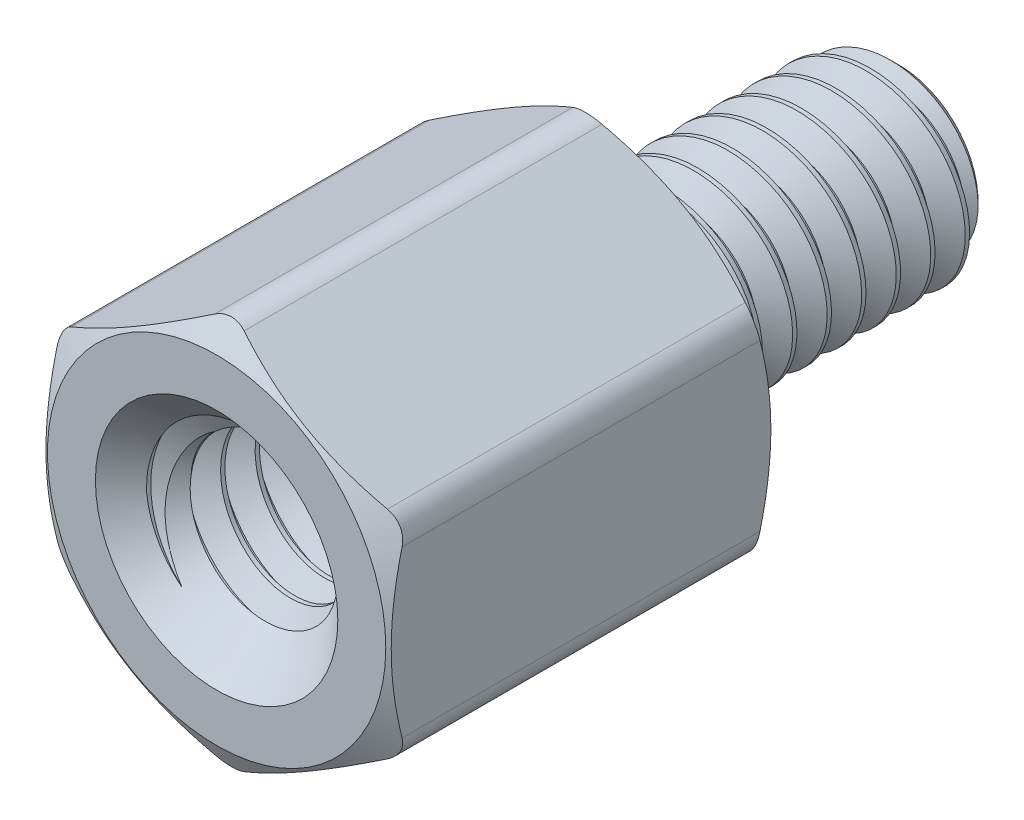
from build123d import *

# Parameters (mm, degrees)
SKETCH4_R           = 1.75
BOSS_EXTRUDE1_DEPTH = 5
SKETCH5_OUTSIDE_W   = 45.262
SKETCH5_OUTSIDE_H   = 45.958
SKETCH5_OUTSIDE_R   = 2.205
CUT_EXTRUDE1_DEPTH  = 10.540571262
CUT_EXTRUDE1_DRAFT  = -60
SKETCH6_OUTSIDE_W   = 33.232
SKETCH6_OUTSIDE_H   = 33.928
SKETCH6_OUTSIDE_R   = 2.205
CUT_EXTRUDE2_DEPTH  = 7.06733055
CUT_EXTRUDE2_DRAFT  = -60
FILLET1_R           = 0.3825
CUT_SWEEP1_PITCH    = 0.45
SKETCH9_R           = 1.475
BOSS_EXTRUDE2_DEPTH = 1.9
SKETCH10_W          = 1.9
SKETCH10_H          = 1.25
CUT_SWEEP2_PITCH    = 0.45


with BuildPart() as part:
    # Sketch3 → Revolve1 (revolve)
    with BuildSketch(Plane(origin=(0, 0, 0), x_dir=(0, 0, -1), z_dir=(1, 0, 0))):
        with BuildLine():
            Line((-3.1, 1.025), (-3.1, 0))
            Line((-3.1, 0), (3.9, 0))
            Line((3.9, 0), (3.9, 1.025))
            Line((3.9, 1.025), (3.675, 1.25))
            Line((3.675, 1.25), (0.63675, 1.25))
            Line((0.63675, 1.25), (0.468, 0.957716426))
            Line((0.468, 0.957716426), (0.225, 0.957716426))
            ThreePointArc((0.225, 0.957716426), (0.065900974, 1.0236174), (0, 1.182716426))
            Line((0, 1.182716426), (0, 2.25))
            Line((0, 2.25), (-5, 2.25))
            Line((-5, 2.25), (-5, 1.475))
            Line((-5, 1.475), (-4.775, 1.25))
            Line((-4.775, 1.25), (-3.325, 1.25))
            Line((-3.325, 1.25), (-3.1, 1.025))
        make_face()
    revolve(axis=Axis((0, 0, -3.9), (0, 0, 1)))

    # Sketch4 → Boss-Extrude1 (add)
    with BuildSketch(Plane.XY.offset(5)):
        Polygon((-2.25, 1.299038106), (-2.25, -1.299038106), (0, -2.598076211), (2.25, -1.299038106), (2.25, 1.299038106), (0, 2.598076211), align=None)
        Circle(SKETCH4_R, mode=Mode.SUBTRACT)
    extrude(amount=-BOSS_EXTRUDE1_DEPTH)


with BuildPart() as cut_extrude1_tool:
    # Sketch5 outside → Cut-Extrude1 (with draft: the straight prism first)
    with BuildSketch(Plane.XY.offset(5)):
        Rectangle(SKETCH5_OUTSIDE_W, SKETCH5_OUTSIDE_H)
        Circle(SKETCH5_OUTSIDE_R, mode=Mode.SUBTRACT)
    extrude(amount=-CUT_EXTRUDE1_DEPTH)
    # Cut-Extrude1: the draft: its side faces are tilted about the plane it starts from
    cut_extrude1_sides = [cut_extrude1_tool.faces().sort_by_distance(p)[0] for p in [
        (0, -22.979, -0.270285631),
        (22.631, 0, -0.270285631),
        (0, 22.979, -0.270285631),
        (-22.631, 0, -0.270285631),
        (-2.205, 0, -0.270285631),
    ]]
    draft(cut_extrude1_sides, Plane.XY.offset(5), CUT_EXTRUDE1_DRAFT)


with BuildPart() as part_1:
    add(part.part)

    # Cut-Extrude1: cut by cut_extrude1_tool
    add(cut_extrude1_tool.part, mode=Mode.SUBTRACT)


with BuildPart() as cut_extrude2_tool:
    # Sketch6 outside → Cut-Extrude2 (with draft: the straight prism first)
    with BuildSketch(Plane(origin=(0, 0, 0), x_dir=(-1, 0, 0), z_dir=(0, 0, -1))):
        Rectangle(SKETCH6_OUTSIDE_W, SKETCH6_OUTSIDE_H)
        Circle(SKETCH6_OUTSIDE_R, mode=Mode.SUBTRACT)
    extrude(amount=-CUT_EXTRUDE2_DEPTH)
    # Cut-Extrude2: the draft: its side faces are tilted about the plane it starts from
    cut_extrude2_sides = [cut_extrude2_tool.faces().sort_by_distance(p)[0] for p in [
        (0, -16.964, 3.533665275),
        (-16.616, 0, 3.533665275),
        (0, 16.964, 3.533665275),
        (16.616, 0, 3.533665275),
        (2.205, 0, 3.533665275),
    ]]
    draft(cut_extrude2_sides, Plane(origin=(0, 0, 0), x_dir=(-1, 0, 0), z_dir=(0, 0, -1)), CUT_EXTRUDE2_DRAFT)


with BuildPart() as part_2:
    add(part_1.part)

    # Cut-Extrude2: cut by cut_extrude2_tool
    add(cut_extrude2_tool.part, mode=Mode.SUBTRACT)

    # Fillet1
    fillet1_edges = [part_2.edges().sort_by_distance(p)[0] for p in [
        (0, 2.598076211, 2.5),
        (-2.25, -1.299038106, 2.5),
        (0, -2.598076211, 2.5),
        (2.25, -1.299038106, 2.5),
        (2.25, 1.299038106, 2.5),
        (-2.25, 1.299038106, 2.5),
    ]]
    fillet(fillet1_edges, radius=FILLET1_R)

    # Cut-Sweep1: the profile of Sketch7 profile screwed along a right-hand helix of 8.406667 turns, 6 arcs to a turn; built about Z, then put on its axis
    cut_sweep1_z = Axis((0, 0, 0), (0, 0, 1))
    cut_sweep1_corners = [(0.957416426, 0, -0.168923205), (0.957416426, 0, -0.224826795), (1.274356964, 0, -0.4078125), (1.274356964, 0, 0.0140625)]
    with BuildLine(mode=Mode.PRIVATE) as cut_sweep1_profile:
        Line(cut_sweep1_corners[0], cut_sweep1_corners[1])
        Line(cut_sweep1_corners[1], cut_sweep1_corners[2])
        Line(cut_sweep1_corners[2], cut_sweep1_corners[3])
        Line(cut_sweep1_corners[3], cut_sweep1_corners[0])
    cut_sweep1_cap = Face(cut_sweep1_profile.wire())
    cut_sweep1_turn_angles = [0, 30, 60, 90, 120, 150, 180, 210, 240, 270, 300, 330, 360]
    cut_sweep1_turn_weights = [1, 0.8660254037844387, 1, 0.8660254037844387, 1, 0.8660254037844387, 1, 0.8660254037844387, 1, 0.8660254037844387, 1, 0.8660254037844387, 1]
    cut_sweep1_turn_rails = [Edge.make_bspline([Vector(p[0], p[1], 0).rotate(cut_sweep1_z, cut_sweep1_turn_angles[k]) / cut_sweep1_turn_weights[k] + Vector(0, 0, p[2] + CUT_SWEEP1_PITCH * cut_sweep1_turn_angles[k] / 360) for k in range(13)], [0, 0, 0, 1, 1, 2, 2, 3, 3, 4, 4, 5, 5, 6, 6, 6], 2, cut_sweep1_turn_weights) for p in cut_sweep1_corners]
    cut_sweep1_turn_sides = [Face.make_surface_from_curves(cut_sweep1_turn_rails[p[0]], cut_sweep1_turn_rails[p[1]]) for p in [(0, 1), (1, 2), (2, 3), (3, 0)]]
    cut_sweep1_last_angles = [2880, 2910, 2940, 2970, 3000, 3013.2, 3026.4]
    cut_sweep1_last_weights = [1, 0.8660254037844387, 1, 0.8660254037844387, 1, 0.9735789028731592, 1]
    cut_sweep1_last_rails = [Edge.make_bspline([Vector(p[0], p[1], 0).rotate(cut_sweep1_z, cut_sweep1_last_angles[k]) / cut_sweep1_last_weights[k] + Vector(0, 0, p[2] + CUT_SWEEP1_PITCH * cut_sweep1_last_angles[k] / 360) for k in range(7)], [0, 0, 0, 1, 1, 2, 2, 3, 3, 3], 2, cut_sweep1_last_weights) for p in cut_sweep1_corners]
    cut_sweep1_last_sides = [Face.make_surface_from_curves(cut_sweep1_last_rails[p[0]], cut_sweep1_last_rails[p[1]]) for p in [(0, 1), (1, 2), (2, 3), (3, 0)]]
    cut_sweep1 = Plane(origin=(0, 0, -3.9), x_dir=(0, 1, 0), z_dir=(0, 0, 1)) * Solid(Shell([*[p.moved(Location((0, 0, CUT_SWEEP1_PITCH * i))) for i in range(8) for p in cut_sweep1_turn_sides], *cut_sweep1_last_sides, cut_sweep1_cap, cut_sweep1_cap.rotate(cut_sweep1_z, 3026.4).moved(Location((0, 0, CUT_SWEEP1_PITCH * 3026.4 / 360)))]))
    add(cut_sweep1, mode=Mode.SUBTRACT)

    # Sketch9 → Boss-Extrude2 (add)
    with BuildSketch(Plane.XY.offset(3.1)):
        Circle(SKETCH9_R)
    extrude(amount=BOSS_EXTRUDE2_DEPTH)


with BuildPart() as body_2:
    # Sketch10 → Revolve2 (revolve)
    with BuildSketch(Plane(origin=(0, 0, 0), x_dir=(0, 0, -1), z_dir=(1, 0, 0))):
        with Locations((-4.05, 0.625)):
            Rectangle(SKETCH10_W, SKETCH10_H)
    revolve(axis=Axis((0, 0, -3.9), (0, 0, 1)))

    # Cut-Sweep2: the profile of Sketch12 profile screwed along a right-hand helix of 5.222222 turns, 6 arcs to a turn; built about Z, then put on its axis
    cut_sweep2_z = Axis((0, 0, 0), (0, 0, 1))
    cut_sweep2_corners = [(0.957416426, 0, -0.224826795), (0.957416426, 0, -0.168923205), (1.274356964, 0, 0.0140625), (1.274356964, 0, -0.4078125)]
    with BuildLine(mode=Mode.PRIVATE) as cut_sweep2_profile:
        Line(cut_sweep2_corners[0], cut_sweep2_corners[1])
        Line(cut_sweep2_corners[1], cut_sweep2_corners[2])
        Line(cut_sweep2_corners[2], cut_sweep2_corners[3])
        Line(cut_sweep2_corners[3], cut_sweep2_corners[0])
    cut_sweep2_cap = Face(cut_sweep2_profile.wire())
    cut_sweep2_turn_angles = [0, 30, 60, 90, 120, 150, 180, 210, 240, 270, 300, 330, 360]
    cut_sweep2_turn_weights = [1, 0.8660254037844387, 1, 0.8660254037844387, 1, 0.8660254037844387, 1, 0.8660254037844387, 1, 0.8660254037844387, 1, 0.8660254037844387, 1]
    cut_sweep2_turn_rails = [Edge.make_bspline([Vector(p[0], p[1], 0).rotate(cut_sweep2_z, cut_sweep2_turn_angles[k]) / cut_sweep2_turn_weights[k] + Vector(0, 0, p[2] + CUT_SWEEP2_PITCH * cut_sweep2_turn_angles[k] / 360) for k in range(13)], [0, 0, 0, 1, 1, 2, 2, 3, 3, 4, 4, 5, 5, 6, 6, 6], 2, cut_sweep2_turn_weights) for p in cut_sweep2_corners]
    cut_sweep2_turn_sides = [Face.make_surface_from_curves(cut_sweep2_turn_rails[p[0]], cut_sweep2_turn_rails[p[1]]) for p in [(0, 1), (1, 2), (2, 3), (3, 0)]]
    cut_sweep2_last_angles = [1800, 1830, 1860, 1870, 1880]
    cut_sweep2_last_weights = [1, 0.8660254037844387, 1, 0.9848077530122011, 1]
    cut_sweep2_last_rails = [Edge.make_bspline([Vector(p[0], p[1], 0).rotate(cut_sweep2_z, cut_sweep2_last_angles[k]) / cut_sweep2_last_weights[k] + Vector(0, 0, p[2] + CUT_SWEEP2_PITCH * cut_sweep2_last_angles[k] / 360) for k in range(5)], [0, 0, 0, 1, 1, 2, 2, 2], 2, cut_sweep2_last_weights) for p in cut_sweep2_corners]
    cut_sweep2_last_sides = [Face.make_surface_from_curves(cut_sweep2_last_rails[p[0]], cut_sweep2_last_rails[p[1]]) for p in [(0, 1), (1, 2), (2, 3), (3, 0)]]
    cut_sweep2 = Plane(origin=(0, 0, 5), x_dir=(0, 1, 0), z_dir=(0, 0, -1)) * Solid(Shell([*[p.moved(Location((0, 0, CUT_SWEEP2_PITCH * i))) for i in range(5) for p in cut_sweep2_turn_sides], *cut_sweep2_last_sides, cut_sweep2_cap, cut_sweep2_cap.rotate(cut_sweep2_z, 1880).moved(Location((0, 0, CUT_SWEEP2_PITCH * 1880 / 360)))]))
    add(cut_sweep2, mode=Mode.SUBTRACT)


with BuildPart() as part_3:
    add(part_2.part)

    # Combine1: cut body 2
    add(body_2.part, mode=Mode.SUBTRACT)

    # Cut-Extrude3 cone 1 section (through the dimple's axis) → Cut-Extrude3 (revolve, cut)
    with BuildSketch(Plane(origin=(0, 0, 5), x_dir=(0, -1, 0), z_dir=(1, 0, 0))):
        Polygon((0, 0), (1.58, 0), (0, 1.58), align=None)
    revolve(axis=Axis((0, 0, 5), (0, 0, -1)), mode=Mode.SUBTRACT)


solid = part_3.part
